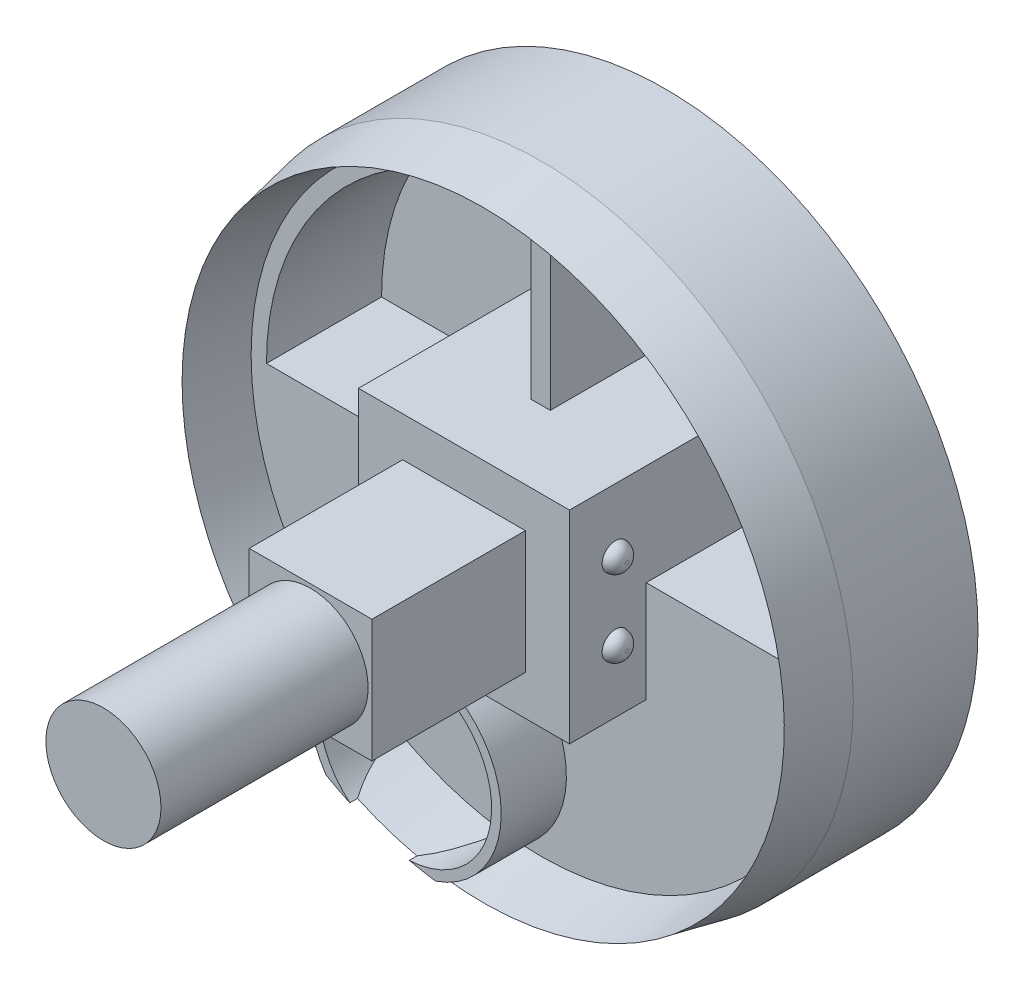
from build123d import *

# Parameters (mm, degrees)
BOSS_EXTRUDE1_DEPTH  = 6.35
SKETCH1_W            = 69.85
SKETCH1_H            = 67.056
BOSS_EXTRUDE2_DEPTH  = 31.75
SKETCH3_R            = 103.505
SKETCH3_R_2          = 90.805
BOSS_EXTRUDE3_DEPTH  = 38.1
BOSS_EXTRUDE4_START  = -3.175
SKETCH3_2_R          = 103.505
BOSS_EXTRUDE4_DEPTH  = 3.175
BOSS_EXTRUDE5_REACH  = 154.086
SKETCH1_3_W          = 69.85
SKETCH1_3_H          = 67.056
BOSS_EXTRUDE6_DEPTH  = 31.75
BOSS_EXTRUDE7_DEPTH  = 21.59
SKETCH8_R            = 4.445
BOSS_EXTRUDE8_DEPTH  = 3.81
FILLET1_R            = 3.81
FILLET1_OF_MIRROR3_R = 3.81
SKETCH9_W            = 40.64
SKETCH9_H            = 40.64
BOSS_EXTRUDE9_DEPTH  = 50.8
SKETCH10_R           = 19.05
BOSS_EXTRUDE10_DEPTH = 68.58


with BuildPart() as part:
    # Sketch2 → Boss-Extrude1 (new body)
    with BuildSketch(Plane.XY):
        with BuildLine():
            Line((-90.805, 0), (-34.925, 0))
            Line((-34.925, 0), (-34.925, -33.528))
            Line((-34.925, -33.528), (34.925, -33.528))
            Line((34.925, -33.528), (34.925, 0))
            Line((34.925, 0), (90.805, 0))
            ThreePointArc((90.805, 0), (0, -90.805), (-90.805, 0))
        make_face()
    extrude(amount=BOSS_EXTRUDE1_DEPTH)

    # Sketch1 → Boss-Extrude2 (add)
    with BuildSketch(Plane.XY):
        Rectangle(SKETCH1_W, SKETCH1_H)
    extrude(amount=BOSS_EXTRUDE2_DEPTH)

    # Sketch3 → Boss-Extrude3 (add)
    with BuildSketch(Plane.XY.offset(-31.75)):
        with Locations(Location((0, 0, 0), (0, 0, 180))):
            Circle(SKETCH3_R)
        Circle(SKETCH3_R_2, mode=Mode.SUBTRACT)
    extrude(amount=BOSS_EXTRUDE3_DEPTH)

    # Sketch3<2> → Boss-Extrude4 (add)
    with BuildSketch(Plane.XY.offset(-31.75).offset(BOSS_EXTRUDE4_START)):
        with Locations(Location((0, 0, 0), (0, 0, 180))):
            Circle(SKETCH3_2_R)
    extrude(amount=BOSS_EXTRUDE4_DEPTH)

    # Boss-Extrude5: up to this face of the body (flat: up to its plane)
    boss_extrude5_end = Plane(part.part.faces().sort_by_distance((0, 0, -31.75))[0])
    # Sketch5 → Boss-Extrude5 (add, up to the picked face)
    with BuildSketch(Plane.XY.offset(6.35), mode=Mode.PRIVATE) as boss_extrude5_sk1:
        with BuildLine():
            Line((-90.805, 0), (-34.925, 0))
            Line((-34.925, 0), (-34.925, -6.35))
            Line((-34.925, -6.35), (-90.582699921, -6.35))
            ThreePointArc((-90.582699921, -6.35), (-90.749407963, -3.176944968), (-90.805, 0))
        make_face()
    boss_extrude5_tool1 = split(extrude(boss_extrude5_sk1.sketch, amount=-BOSS_EXTRUDE5_REACH, mode=Mode.PRIVATE), bisect_by=boss_extrude5_end, keep=Keep.BOTH, mode=Mode.PRIVATE)
    # Sketch5 → Boss-Extrude5 (add, up to the picked face)
    with BuildSketch(Plane.XY.offset(6.35), mode=Mode.PRIVATE) as boss_extrude5_sk2:
        with BuildLine():
            Line((34.925, 0), (90.805, 0))
            ThreePointArc((90.805, 0), (90.749407963, -3.176944968), (90.582699921, -6.35))
            Line((90.582699921, -6.35), (34.925, -6.35))
            Line((34.925, -6.35), (34.925, 0))
        make_face()
    boss_extrude5_tool2 = split(extrude(boss_extrude5_sk2.sketch, amount=-BOSS_EXTRUDE5_REACH, mode=Mode.PRIVATE), bisect_by=boss_extrude5_end, keep=Keep.BOTH, mode=Mode.PRIVATE)
    # Sketch5 → Boss-Extrude5 (add, up to the picked face)
    with BuildSketch(Plane.XY.offset(6.35), mode=Mode.PRIVATE) as boss_extrude5_sk3:
        Polygon((0, 33.528), (3.175, 33.528), (3.175, 94.488), (-3.175, 94.488), (-3.175, 33.528), align=None)
    boss_extrude5_tool3 = split(extrude(boss_extrude5_sk3.sketch, amount=-BOSS_EXTRUDE5_REACH, mode=Mode.PRIVATE), bisect_by=boss_extrude5_end, keep=Keep.BOTH, mode=Mode.PRIVATE)
    add(boss_extrude5_tool1.solids().sort_by(Axis((-62.828007, -3.172893, 6.35), (0, 0, -1)))[0])
    add(boss_extrude5_tool2.solids().sort_by(Axis((62.828007, -3.172893, 6.35), (0, 0, -1)))[0])
    add(boss_extrude5_tool3.solids().sort_by(Axis((0, 64.008, 6.35), (0, 0, -1)))[0])

    # Sketch1<3> → Boss-Extrude6 (add)
    with BuildSketch(Plane.XY):
        Rectangle(SKETCH1_3_W, SKETCH1_3_H)
    extrude(amount=-BOSS_EXTRUDE6_DEPTH)

    # Sketch6 → Revolve1 (revolve)
    with BuildSketch(Plane(origin=(0, 0, 0), x_dir=(1, 0, 0), z_dir=(0, 1, 0))):
        Polygon((-103.505, -6.35), (-99.695, -25.4), (-95.885, -6.35), align=None)
    revolve(axis=Axis((0, 0, 0), (0, 0, 1)))

    # Sketch7 → Boss-Extrude7 (add)
    with BuildSketch(Plane.XY.offset(6.35)):
        with BuildLine():
            ThreePointArc((-13.17823844, -98.820175352), (-13.067443237, -38.631075363), (-49.51802331, -86.527789712))
            ThreePointArc((-49.51802331, -86.527789712), (-45.608408723, -88.650809803), (-41.607971429, -90.597294323))
            ThreePointArc((-41.607971429, -90.597294323), (-14.084798914, -41.638667826), (-21.934434586, -97.252113624))
            ThreePointArc((-21.934434586, -97.252113624), (-17.573834418, -98.133854346), (-13.17823844, -98.820175352))
        make_face()
    extrude(amount=BOSS_EXTRUDE7_DEPTH)

    # Sketch8 → Boss-Extrude8 (add)
    with BuildSketch(Plane(origin=(34.925, 0, 0), x_dir=(0, 0, -1), z_dir=(1, 0, 0))):
        with Locations(Location((-16.51, 12.7, 0), (0, 0, 180))):
            Circle(SKETCH8_R)
        with Locations(Location((-16.51, -12.7, 0), (0, 0, 180))):
            Circle(SKETCH8_R)
    boss_extrude8 = extrude(amount=BOSS_EXTRUDE8_DEPTH)

    # Fillet1
    fillet1_edges = [part.edges().sort_by_distance(p)[0] for p in [
        (38.735, 12.7, 12.065),
        (38.735, -12.7, 12.065),
    ]]
    fillet(fillet1_edges, radius=FILLET1_R - 0.0001)  # a hair under: the kernel refuses the full size

    # Mirror3: Boss-Extrude8 across plane
    add(boss_extrude8.mirror(Plane(origin=(0, 0, 0), x_dir=(0, 0, 1), z_dir=(1, 0, 0))))

    # Fillet1 of Mirror3
    fillet1_of_mirror3_edges = [part.edges().sort_by_distance(p)[0] for p in [
        (-38.735, 12.7, 12.065),
        (-38.735, -12.7, 12.065),
    ]]
    fillet(fillet1_of_mirror3_edges, radius=FILLET1_OF_MIRROR3_R - 0.0001)  # a hair under: the kernel refuses the full size

    # Sketch9 → Boss-Extrude9 (add)
    with BuildSketch(Plane.XY.offset(31.75)):
        Rectangle(SKETCH9_W, SKETCH9_H)
    extrude(amount=BOSS_EXTRUDE9_DEPTH)

    # Sketch10 → Boss-Extrude10 (add)
    with BuildSketch(Plane.XY.offset(82.55)):
        Circle(SKETCH10_R)
    extrude(amount=BOSS_EXTRUDE10_DEPTH)


solid = part.part
